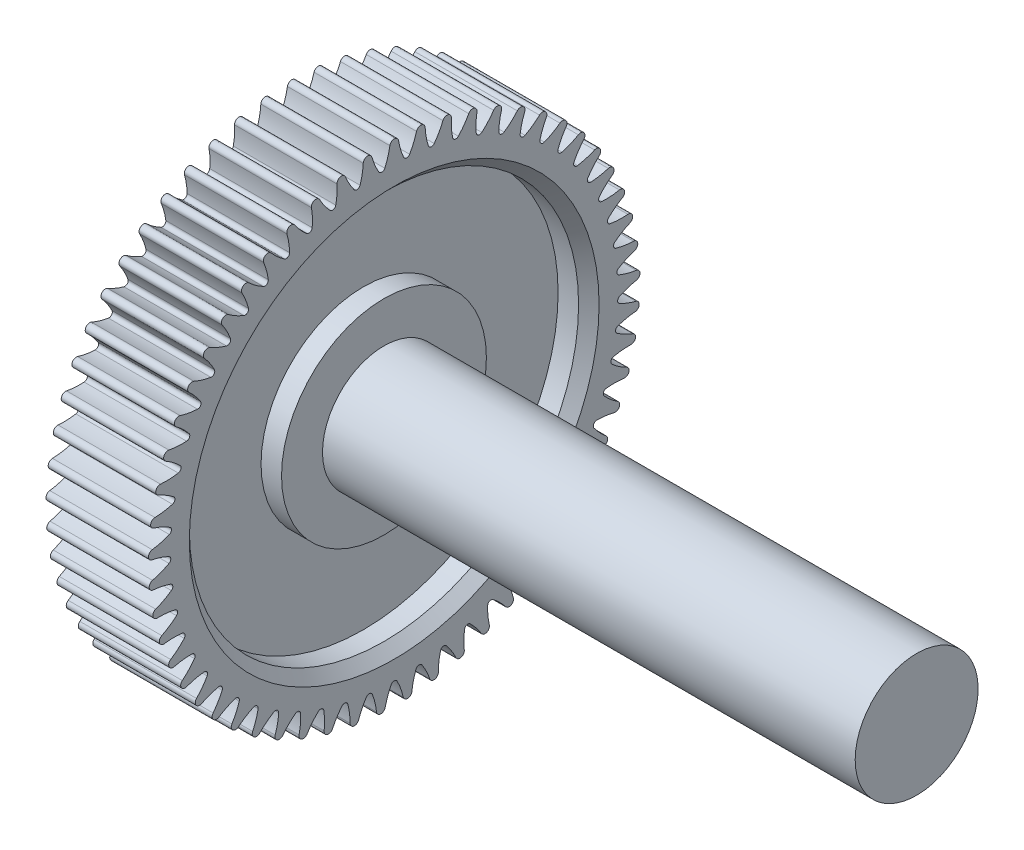
from build123d import *

# Parameters (mm, degrees)
CUT_EXTRUDE1_DEPTH = 10


with BuildPart() as part:
    # Sketch1 → Revolve1 (revolve)
    with BuildSketch(Plane.XY):
        with BuildLine():
            Line((0, 0), (61, 0))
            Line((61, 0), (61, -6))
            Line((61, -6), (9, -6))
            Line((9, -6), (9, -10))
            Line((9, -10), (7, -10))
            Line((7, -10), (7, -19))
            Line((7, -19), (9, -19))
            Line((9, -19), (10, -20))
            Line((10, -20), (10, -24))
            Line((10, -24), (0, -24))
            Line((0, -24), (0, -20))
            Line((0, -20), (1, -19))
            Line((1, -19), (3, -19))
            Line((3, -19), (3, -10))
            ThreePointArc((3, -10), (2.16227766, -7.550510257), (0, -6.127016654))
            Line((0, -6.127016654), (0, 0))
        make_face()
    revolve(axis=Axis((0, 0, 0), (1, 0, 0)))

    # Sketch3 → Cut-Extrude1 (cut)
    with BuildSketch(Plane(origin=(10, 0, 0), x_dir=(0, 0, -1), z_dir=(1, 0, 0))):
        with BuildLine():
            ThreePointArc((-0.92, 21.980755219), (-0.618669103, 22.793939627), (-0.424408131, 23.639121186))
            ThreePointArc((-0.424408131, 23.639121186), (-0.278547922, 23.897583661), (0, 24))
            ThreePointArc((0, 24), (-1.322106207, 23.963556397), (-2.640197222, 23.854336265))
            ThreePointArc((-2.640197222, 23.854336265), (-2.352073305, 23.783184053), (-2.178665406, 23.542336115))
            ThreePointArc((-2.178665406, 23.542336115), (-1.892606548, 22.72365454), (-1.503647555, 21.948554486))
            ThreePointArc((-1.503647555, 21.948554486), (-1.201993083, 21.786470696), (-0.92, 21.980755219))
        make_face()
        with BuildLine():
            ThreePointArc((2.640197229, 23.854336264), (1.322106211, 23.963556396), (0, 24))
            ThreePointArc((0, 24), (0.278547922, 23.897583661), (0.424408131, 23.639121186))
            ThreePointArc((0.424408131, 23.639121186), (0.618669103, 22.793939627), (0.92, 21.980755219))
            ThreePointArc((0.92, 21.980755219), (1.201993083, 21.786470696), (1.503647555, 21.948554486))
            ThreePointArc((1.503647555, 21.948554486), (1.892606548, 22.72365454), (2.178665406, 23.542336115))
            ThreePointArc((2.178665406, 23.542336115), (2.352073308, 23.783184055), (2.640197229, 23.854336264))
        make_face()
        with BuildLine():
            ThreePointArc((5.248346399, 23.419113136), (3.950270236, 23.67267127), (2.640197229, 23.854336264))
            ThreePointArc((2.640197229, 23.854336264), (2.905787964, 23.72189898), (3.022329929, 23.448959348))
            ThreePointArc((3.022329929, 23.448959348), (3.122434948, 22.587537165), (3.332480001, 21.74613936))
            ThreePointArc((3.332480001, 21.74613936), (3.591388683, 21.522012454), (3.909042865, 21.649928034))
            ThreePointArc((3.909042865, 21.649928034), (4.380908518, 22.377535069), (4.755292897, 23.159778975))
            ThreePointArc((4.755292897, 23.159778975), (4.954143712, 23.380088904), (5.248346399, 23.419113136))
        make_face()
        with BuildLine():
            ThreePointArc((-3.022329929, 23.448959348), (-2.905787962, 23.721898983), (-2.640197222, 23.854336265))
            ThreePointArc((-2.640197222, 23.854336265), (-3.950270132, 23.672671287), (-5.2483462, 23.41911318))
            ThreePointArc((-5.2483462, 23.41911318), (-4.954143622, 23.380088856), (-4.755292897, 23.159778975))
            ThreePointArc((-4.755292897, 23.159778975), (-4.380908518, 22.377535069), (-3.909042865, 21.649928034))
            ThreePointArc((-3.909042865, 21.649928034), (-3.591388683, 21.522012454), (-3.332480001, 21.74613936))
            ThreePointArc((-3.332480001, 21.74613936), (-3.122434948, 22.587537165), (-3.022329929, 23.448959348))
        make_face()
        with BuildLine():
            ThreePointArc((7.792786988, 22.699613894), (6.530483121, 23.094432017), (5.248346399, 23.419113136))
            ThreePointArc((5.248346399, 23.419113136), (5.497755792, 23.25826244), (5.583564735, 22.974158908))
            ThreePointArc((5.583564735, 22.974158908), (5.588298663, 22.1069526), (5.704508209, 21.247554826))
            ThreePointArc((5.704508209, 21.247554826), (5.937189688, 20.996306136), (6.26698769, 21.088500783))
            ThreePointArc((6.26698769, 21.088500783), (6.816032194, 21.759782635), (7.274197574, 22.496093491))
            ThreePointArc((7.274197574, 22.496093491), (7.496077168, 22.693190971), (7.792786988, 22.699613894))
        make_face()
        with BuildLine():
            ThreePointArc((-5.583564735, 22.974158908), (-5.497755731, 23.258262522), (-5.2483462, 23.41911318))
            ThreePointArc((-5.2483462, 23.41911318), (-6.530483116, 23.094432019), (-7.792787171, 22.699613832))
            ThreePointArc((-7.792787171, 22.699613832), (-7.496077258, 22.693191007), (-7.274197574, 22.496093491))
            ThreePointArc((-7.274197574, 22.496093491), (-6.816032194, 21.759782635), (-6.26698769, 21.088500783))
            ThreePointArc((-6.26698769, 21.088500783), (-5.937189688, 20.996306136), (-5.704508209, 21.247554826))
            ThreePointArc((-5.704508209, 21.247554826), (-5.588298663, 22.1069526), (-5.583564735, 22.974158908))
        make_face()
        with BuildLine():
            ThreePointArc((10.242634451, 21.704571857), (9.031424793, 22.235857667), (7.792786988, 22.699613894))
            ThreePointArc((7.792786988, 22.699613894), (8.022988084, 22.512302423), (8.077022629, 22.220483301))
            ThreePointArc((8.077022629, 22.220483301), (7.986328002, 21.358019577), (8.007291415, 20.49105376))
            ThreePointArc((8.007291415, 20.49105376), (8.210921253, 20.215733104), (8.548859774, 20.271087701))
            ThreePointArc((8.548859774, 20.271087701), (9.168418472, 20.877895917), (9.704803345, 21.559335906))
            ThreePointArc((9.704803345, 21.559335906), (9.947018763, 21.730828597), (10.242634451, 21.704571857))
        make_face()
        with BuildLine():
            ThreePointArc((-8.077022629, 22.220483301), (-8.022988133, 22.51230234), (-7.792787171, 22.699613832))
            ThreePointArc((-7.792787171, 22.699613832), (-9.031424873, 22.235857635), (-10.242634433, 21.704571866))
            ThreePointArc((-10.242634433, 21.704571866), (-9.947018753, 21.730828594), (-9.704803345, 21.559335906))
            ThreePointArc((-9.704803345, 21.559335906), (-9.168418472, 20.877895917), (-8.548859774, 20.271087701))
            ThreePointArc((-8.548859774, 20.271087701), (-8.210921253, 20.215733104), (-8.007291415, 20.49105376))
            ThreePointArc((-8.007291415, 20.49105376), (-7.986328002, 21.358019577), (-8.077022629, 22.220483301))
        make_face()
        with BuildLine():
            ThreePointArc((12.56814958, 20.446066031), (11.422737249, 21.107370129), (10.242634451, 21.704571857))
            ThreePointArc((10.242634451, 21.704571857), (10.45083238, 21.493073218), (10.47243641, 21.197081127))
            ThreePointArc((10.47243641, 21.197081127), (10.287414138, 20.349829128), (10.21287695, 19.485819059))
            ThreePointArc((10.21287695, 19.485819059), (10.384983358, 19.189768456), (10.726960281, 19.207611073))
            ThreePointArc((10.726960281, 19.207611073), (11.40951257, 19.742579824), (12.017605951, 20.360877189))
            ThreePointArc((12.017605951, 20.360877189), (12.277216685, 20.504683315), (12.56814958, 20.446066031))
        make_face()
        with BuildLine():
            ThreePointArc((-10.47243641, 21.197081127), (-10.450832376, 21.493073227), (-10.242634433, 21.704571866))
            ThreePointArc((-10.242634433, 21.704571866), (-11.422737525, 21.107369979), (-12.568150132, 20.446065691))
            ThreePointArc((-12.568150132, 20.446065691), (-12.277217006, 20.504683365), (-12.017605951, 20.360877189))
            ThreePointArc((-12.017605951, 20.360877189), (-11.40951257, 19.742579824), (-10.726960281, 19.207611073))
            ThreePointArc((-10.726960281, 19.207611073), (-10.384983358, 19.189768456), (-10.21287695, 19.485819059))
            ThreePointArc((-10.21287695, 19.485819059), (-10.287414138, 20.349829128), (-10.47243641, 21.197081127))
        make_face()
        with BuildLine():
            ThreePointArc((14.741104724, 18.939372522), (13.67539301, 19.722667822), (12.56814958, 20.446066031))
            ThreePointArc((12.56814958, 20.446066031), (12.75181759, 20.212947541), (12.740728999, 19.916375103))
            ThreePointArc((12.740728999, 19.916375103), (12.463625002, 19.094619321), (12.294491993, 18.244052911))
            ThreePointArc((12.294491993, 18.244052911), (12.432985832, 17.930866015), (12.774850021, 17.910980066))
            ThreePointArc((12.774850021, 17.910980066), (13.512110641, 18.367615556), (14.1845311, 18.915265004))
            ThreePointArc((14.1845311, 18.915265004), (14.458385997, 19.029639008), (14.741104724, 18.939372522))
        make_face()
        with BuildLine():
            ThreePointArc((-12.740728999, 19.916375103), (-12.75181769, 20.212947233), (-12.568150132, 20.446065691))
            ThreePointArc((-12.568150132, 20.446065691), (-13.67539335, 19.722667587), (-14.741104864, 18.939372413))
            ThreePointArc((-14.741104864, 18.939372413), (-14.458386085, 19.029639012), (-14.1845311, 18.915265004))
            ThreePointArc((-14.1845311, 18.915265004), (-13.512110641, 18.367615556), (-12.774850021, 17.910980066))
            ThreePointArc((-12.774850021, 17.910980066), (-12.432985832, 17.930866015), (-12.294491993, 18.244052911))
            ThreePointArc((-12.294491993, 18.244052911), (-12.463625002, 19.094619321), (-12.740728999, 19.916375103))
        make_face()
        with BuildLine():
            ThreePointArc((16.735122832, 17.2027807), (15.762048188, 18.098558974), (14.741104724, 18.939372522))
            ThreePointArc((14.741104724, 18.939372522), (14.898013087, 18.687463905), (14.854366398, 18.393911265))
            ThreePointArc((14.854366398, 18.393911265), (14.488544342, 17.607626701), (14.226868559, 16.780828675))
            ThreePointArc((14.226868559, 16.780828675), (14.3300687, 16.45430715), (14.667670388, 16.396934024))
            ThreePointArc((14.667670388, 16.396934024), (15.450689992, 16.769693317), (16.179275257, 17.240047125))
            ThreePointArc((16.179275257, 17.240047125), (16.464050086, 17.323600669), (16.735122832, 17.2027807))
        make_face()
        with BuildLine():
            ThreePointArc((-14.854366398, 18.393911265), (-14.898013106, 18.687463818), (-14.741104864, 18.939372413))
            ThreePointArc((-14.741104864, 18.939372413), (-15.762048321, 18.098558857), (-16.735122958, 17.202780577))
            ThreePointArc((-16.735122958, 17.202780577), (-16.464050174, 17.323600663), (-16.179275257, 17.240047125))
            ThreePointArc((-16.179275257, 17.240047125), (-15.450689992, 16.769693317), (-14.667670388, 16.396934024))
            ThreePointArc((-14.667670388, 16.396934024), (-14.3300687, 16.45430715), (-14.226868559, 16.780828675))
            ThreePointArc((-14.226868559, 16.780828675), (-14.488544342, 17.607626701), (-14.854366398, 18.393911265))
        make_face()
        with BuildLine():
            ThreePointArc((18.525999644, 15.25736993), (17.657373682, 16.254757909), (16.735122832, 17.2027807))
            ThreePointArc((16.735122832, 17.2027807), (16.863366895, 16.935139774), (16.78769191, 16.64817026))
            ThreePointArc((16.78769191, 16.64817026), (16.337592381, 15.906901345), (15.986550212, 15.11390791))
            ThreePointArc((15.986550212, 15.11390791), (16.053203946, 14.778015286), (16.382445105, 14.683851415))
            ThreePointArc((16.382445105, 14.683851415), (17.201718897, 14.968209718), (17.977624928, 15.355558428))
            ThreePointArc((17.977624928, 15.355558428), (18.269863232, 15.407277234), (18.525999644, 15.25736993))
        make_face()
        with BuildLine():
            ThreePointArc((-16.78769191, 16.64817026), (-16.863366903, 16.935139686), (-16.735122958, 17.202780577))
            ThreePointArc((-16.735122958, 17.202780577), (-17.657373715, 16.254757872), (-18.525999595, 15.25736999))
            ThreePointArc((-18.525999595, 15.25736999), (-18.269863194, 15.407277241), (-17.977624928, 15.355558428))
            ThreePointArc((-17.977624928, 15.355558428), (-17.201718897, 14.968209718), (-16.382445105, 14.683851415))
            ThreePointArc((-16.382445105, 14.683851415), (-16.053203946, 14.778015286), (-15.986550212, 15.11390791))
            ThreePointArc((-15.986550212, 15.11390791), (-16.337592381, 15.906901345), (-16.78769191, 16.64817026))
        make_face()
        with BuildLine():
            ThreePointArc((20.09199551, 13.126755746), (19.338362563, 14.213646027), (18.525999644, 15.25736993))
            ThreePointArc((18.525999644, 15.25736993), (18.624022274, 14.977245661), (18.517237584, 14.700343021))
            ThreePointArc((18.517237584, 14.700343021), (17.988324179, 14.013087755), (17.552176802, 13.263524778))
            ThreePointArc((17.552176802, 13.263524778), (17.581475043, 12.922338336), (17.898359131, 12.792526741))
            ThreePointArc((17.898359131, 12.792526741), (18.743942237, 12.985032329), (19.557750587, 13.284674053))
            ThreePointArc((19.557750587, 13.284674053), (19.853904707, 13.303930342), (20.09199551, 13.126755746))
        make_face()
        with BuildLine():
            ThreePointArc((-18.517237584, 14.700343021), (-18.624022274, 14.9772457), (-18.525999595, 15.25736999))
            ThreePointArc((-18.525999595, 15.25736999), (-19.338362541, 14.213646058), (-20.09199551, 13.126755746))
            ThreePointArc((-20.09199551, 13.126755746), (-19.853904707, 13.303930342), (-19.557750587, 13.284674053))
            ThreePointArc((-19.557750587, 13.284674053), (-18.743942237, 12.985032329), (-17.898359131, 12.792526741))
            ThreePointArc((-17.898359131, 12.792526741), (-17.581475043, 12.922338336), (-17.552176802, 13.263524778))
            ThreePointArc((-17.552176802, 13.263524778), (-17.988324179, 14.013087755), (-18.517237584, 14.700343021))
        make_face()
        with BuildLine():
            ThreePointArc((21.414101755, 10.836800544), (20.784609721, 11.999999948), (20.09199551, 13.126755746))
            ThreePointArc((20.09199551, 13.126755746), (20.158607222, 12.837548355), (20.022009078, 12.574073532))
            ThreePointArc((20.022009078, 12.574073532), (19.42070209, 11.949174262), (18.904743742, 11.252140421))
            ThreePointArc((18.904743742, 11.252140421), (18.896330849, 10.909801703), (19.197011323, 10.745918122))
            ThreePointArc((19.197011323, 10.745918122), (20.05863951, 10.844234238), (20.900471646, 11.05253173))
            ThreePointArc((20.900471646, 11.05253173), (21.196946664, 11.039091758), (21.414101755, 10.836800544))
        make_face()
        with BuildLine():
            ThreePointArc((-20.022009078, 12.574073532), (-20.158607222, 12.837548355), (-20.09199551, 13.126755746))
            ThreePointArc((-20.09199551, 13.126755746), (-20.78460969, 12.000000002), (-21.414101699, 10.836800655))
            ThreePointArc((-21.414101699, 10.836800655), (-21.196946607, 11.039091782), (-20.900471646, 11.05253173))
            ThreePointArc((-20.900471646, 11.05253173), (-20.05863951, 10.844234238), (-19.197011323, 10.745918122))
            ThreePointArc((-19.197011323, 10.745918122), (-18.896330849, 10.909801703), (-18.904743742, 11.252140421))
            ThreePointArc((-18.904743742, 11.252140421), (-19.42070209, 11.949174262), (-20.022009078, 12.574073532))
        make_face()
        with BuildLine():
            ThreePointArc((22.476269758, 8.415301408), (21.978559834, 9.640690204), (21.414101755, 10.836800544))
            ThreePointArc((21.414101755, 10.836800544), (21.448493986, 10.542020611), (21.283740504, 10.295171823))
            ThreePointArc((21.283740504, 10.295171823), (20.617338985, 9.74021398), (20.027832702, 9.104170323))
            ThreePointArc((20.027832702, 9.104170323), (19.981810797, 8.764834856), (20.262637802, 8.568868613))
            ThreePointArc((20.262637802, 8.568868613), (21.129852071, 8.571801833), (21.989489293, 8.686226645))
            ThreePointArc((21.989489293, 8.686226645), (22.282686335, 8.640253592), (22.476269758, 8.415301408))
        make_face()
        with BuildLine():
            ThreePointArc((-21.283740504, 10.295171823), (-21.448494, 10.542020672), (-21.414101699, 10.836800655))
            ThreePointArc((-21.414101699, 10.836800655), (-21.97855981, 9.640690261), (-22.476269758, 8.415301408))
            ThreePointArc((-22.476269758, 8.415301408), (-22.282686335, 8.640253592), (-21.989489293, 8.686226645))
            ThreePointArc((-21.989489293, 8.686226645), (-21.129852071, 8.571801833), (-20.262637802, 8.568868613))
            ThreePointArc((-20.262637802, 8.568868613), (-19.981810797, 8.764834856), (-20.027832702, 9.104170323))
            ThreePointArc((-20.027832702, 9.104170323), (-20.617338985, 9.74021398), (-21.283740504, 10.295171823))
        make_face()
        with BuildLine():
            ThreePointArc((23.265606381, 5.891651696), (22.905720031, 7.164355508), (22.476269758, 8.415301408))
            ThreePointArc((22.476269758, 8.415301408), (22.478025113, 8.118527091), (22.287116152, 7.891300674))
            ThreePointArc((22.287116152, 7.891300674), (21.563709314, 7.413020695), (20.907810903, 6.845687929))
            ThreePointArc((20.907810903, 6.845687929), (20.824738629, 6.513474787), (21.082303307, 6.287804647))
            ThreePointArc((21.082303307, 6.287804647), (21.94457685, 6.195319366), (22.811584327, 6.214482535))
            ThreePointArc((22.811584327, 6.214482535), (23.097944482, 6.136534398), (23.265606381, 5.891651696))
        make_face()
        with BuildLine():
            ThreePointArc((-22.287116152, 7.891300674), (-22.478025113, 8.118527091), (-22.476269758, 8.415301408))
            ThreePointArc((-22.476269758, 8.415301408), (-22.905720023, 7.164355535), (-23.265606368, 5.891651749))
            ThreePointArc((-23.265606368, 5.891651749), (-23.09794446, 6.136534414), (-22.811584327, 6.214482535))
            ThreePointArc((-22.811584327, 6.214482535), (-21.94457685, 6.195319366), (-21.082303307, 6.287804647))
            ThreePointArc((-21.082303307, 6.287804647), (-20.824738629, 6.513474787), (-20.907810903, 6.845687929))
            ThreePointArc((-20.907810903, 6.845687929), (-21.563709314, 7.413020695), (-22.287116152, 7.891300674))
        make_face()
        with BuildLine():
            ThreePointArc((23.772530026, 3.296485424), (23.554835834, 4.601055186), (23.265606381, 5.891651696))
            ThreePointArc((23.265606381, 5.891651696), (23.23470343, 5.596485538), (23.019956401, 5.391639825))
            ThreePointArc((23.019956401, 5.391639825), (22.248325423, 4.995843381), (21.533996603, 4.504108158))
            ThreePointArc((21.533996603, 4.504108158), (21.414882344, 4.183049957), (21.646058208, 3.930415251))
            ThreePointArc((21.646058208, 3.930415251), (22.492924194, 3.743634114), (23.356777629, 3.667303025))
            ThreePointArc((23.356777629, 3.667303025), (23.632824824, 3.55832602), (23.772530026, 3.296485424))
        make_face()
        with BuildLine():
            ThreePointArc((-23.019956401, 5.391639825), (-23.234703442, 5.596485563), (-23.265606368, 5.891651749))
            ThreePointArc((-23.265606368, 5.891651749), (-23.554835829, 4.601055213), (-23.772530026, 3.296485424))
            ThreePointArc((-23.772530026, 3.296485424), (-23.632824824, 3.55832602), (-23.356777629, 3.667303025))
            ThreePointArc((-23.356777629, 3.667303025), (-22.492924194, 3.743634114), (-21.646058208, 3.930415251))
            ThreePointArc((-21.646058208, 3.930415251), (-21.414882344, 4.183049957), (-21.533996603, 4.504108158))
            ThreePointArc((-21.533996603, 4.504108158), (-22.248325423, 4.995843381), (-23.019956401, 5.391639825))
        make_face()
        with BuildLine():
            ThreePointArc((23.99088737, 0.661304173), (23.918027832, 1.981904288), (23.772530026, 3.296485424))
            ThreePointArc((23.772530026, 3.296485424), (23.709343944, 3.006510286), (23.473365563, 2.826531772))
            ThreePointArc((23.473365563, 2.826531772), (22.662876999, 2.518023295), (21.898788755, 2.107854615))
            ThreePointArc((21.898788755, 2.107854615), (21.745078397, 1.801848568), (21.947059286, 1.525315937))
            ThreePointArc((21.947059286, 1.525315937), (22.768237908, 1.246506215), (23.61845129, 1.075607425))
            ThreePointArc((23.61845129, 1.075607425), (23.880834726, 0.936924345), (23.99088737, 0.661304173))
        make_face()
        with BuildLine():
            ThreePointArc((-23.473365563, 2.826531772), (-23.709343944, 3.006510286), (-23.772530026, 3.296485424))
            ThreePointArc((-23.772530026, 3.296485424), (-23.91802783, 1.981904312), (-23.990887368, 0.661304221))
            ThreePointArc((-23.990887368, 0.661304221), (-23.88083471, 0.936924363), (-23.61845129, 1.075607425))
            ThreePointArc((-23.61845129, 1.075607425), (-22.768237908, 1.246506215), (-21.947059286, 1.525315937))
            ThreePointArc((-21.947059286, 1.525315937), (-21.745078397, 1.801848568), (-21.898788755, 2.107854615))
            ThreePointArc((-21.898788755, 2.107854615), (-22.662876999, 2.518023295), (-23.473365563, 2.826531772))
        make_face()
        with BuildLine():
            ThreePointArc((23.918027836, -1.981904251), (23.990887369, -0.661304219), (23.99088737, 0.661304173))
            ThreePointArc((23.99088737, 0.661304173), (23.896185107, 0.380040025), (23.641839864, 0.227113452))
            ThreePointArc((23.641839864, 0.227113452), (22.802331949, 0.009637818), (21.997759276, -0.313985428))
            ThreePointArc((21.997759276, -0.313985428), (21.811318655, -0.601224823), (21.981652794, -0.898298645))
            ThreePointArc((21.981652794, -0.898298645), (22.767176057, -1.265752581), (23.593428948, -1.529144593))
            ThreePointArc((23.593428948, -1.529144593), (23.83896359, -1.69585026), (23.918027836, -1.981904251))
        make_face()
        with BuildLine():
            ThreePointArc((-23.641839864, 0.227113452), (-23.896185122, 0.380040044), (-23.990887368, 0.661304221))
            ThreePointArc((-23.990887368, 0.661304221), (-23.990887367, -0.66130426), (-23.918027825, -1.981904381))
            ThreePointArc((-23.918027825, -1.981904381), (-23.838963628, -1.695850314), (-23.593428948, -1.529144593))
            ThreePointArc((-23.593428948, -1.529144593), (-22.767176057, -1.265752581), (-21.981652794, -0.898298645))
            ThreePointArc((-21.981652794, -0.898298645), (-21.811318655, -0.601224823), (-21.997759276, -0.313985428))
            ThreePointArc((-21.997759276, -0.313985428), (-22.802331949, 0.009637818), (-23.641839864, 0.227113452))
        make_face()
        with BuildLine():
            ThreePointArc((-23.523334256, -2.375061717), (-23.79295896, -2.251043389), (-23.918027825, -1.981904381))
            ThreePointArc((-23.918027825, -1.981904381), (-23.772530029, -3.296485403), (-23.554835849, -4.601055108))
            ThreePointArc((-23.554835849, -4.601055108), (-23.507719753, -4.308039565), (-23.282014338, -4.115334867))
            ThreePointArc((-23.282014338, -4.115334867), (-22.489751529, -3.762646855), (-21.749418814, -3.311009099))
            ThreePointArc((-21.749418814, -3.311009099), (-21.612799051, -2.997000158), (-21.829706798, -2.732014113))
            ThreePointArc((-21.829706798, -2.732014113), (-22.664997478, -2.498864649), (-23.523334256, -2.375061717))
        make_face()
        with BuildLine():
            ThreePointArc((23.554835833, -4.601055193), (23.772530032, -3.296485381), (23.918027836, -1.981904251))
            ThreePointArc((23.918027836, -1.981904251), (23.792959006, -2.251043343), (23.523334256, -2.375061717))
            ThreePointArc((23.523334256, -2.375061717), (22.664997478, -2.498864649), (21.829706798, -2.732014113))
            ThreePointArc((21.829706798, -2.732014113), (21.612799051, -2.997000158), (21.749418814, -3.311009099))
            ThreePointArc((21.749418814, -3.311009099), (22.489751529, -3.762646855), (23.282014338, -4.115334867))
            ThreePointArc((23.282014338, -4.115334867), (23.507719774, -4.308039603), (23.554835833, -4.601055193))
        make_face()
        with BuildLine():
            ThreePointArc((-23.119287236, -4.948406855), (-23.400918594, -4.854802121), (-23.554835849, -4.601055108))
            ThreePointArc((-23.554835849, -4.601055108), (-23.265606392, -5.891651655), (-22.90572005, -7.164355448))
            ThreePointArc((-22.90572005, -7.164355448), (-22.891124056, -6.867935132), (-22.687987613, -6.65157055))
            ThreePointArc((-22.687987613, -6.65157055), (-21.939331883, -6.213867694), (-21.253176352, -5.683528388))
            ThreePointArc((-21.253176352, -5.683528388), (-21.151929344, -5.356395971), (-21.396671251, -5.116879847))
            ThreePointArc((-21.396671251, -5.116879847), (-22.25254064, -4.977034285), (-23.119287236, -4.948406855))
        make_face()
        with BuildLine():
            ThreePointArc((22.905720023, -7.164355535), (23.26560637, -5.891651741), (23.554835833, -4.601055193))
            ThreePointArc((23.554835833, -4.601055193), (23.40091856, -4.854802148), (23.119287236, -4.948406855))
            ThreePointArc((23.119287236, -4.948406855), (22.25254064, -4.977034285), (21.396671251, -5.116879847))
            ThreePointArc((21.396671251, -5.116879847), (21.151929344, -5.356395971), (21.253176352, -5.683528388))
            ThreePointArc((21.253176352, -5.683528388), (21.939331883, -6.213867694), (22.687987613, -6.65157055))
            ThreePointArc((22.687987613, -6.65157055), (22.891124074, -6.867935174), (22.905720023, -7.164355535))
        make_face()
        with BuildLine():
            ThreePointArc((-22.434603387, -7.461685036), (-22.724822706, -7.399630196), (-22.90572005, -7.164355448))
            ThreePointArc((-22.90572005, -7.164355448), (-22.476269804, -8.415301283), (-21.978559868, -9.640690127))
            ThreePointArc((-21.978559868, -9.640690127), (-21.996661104, -9.344463225), (-21.818559452, -9.107065177))
            ThreePointArc((-21.818559452, -9.107065177), (-21.122598468, -8.589660596), (-20.49894912, -7.987057341))
            ThreePointArc((-20.49894912, -7.987057341), (-20.434303867, -7.650772393), (-20.7039091, -7.439633592))
            ThreePointArc((-20.7039091, -7.439633592), (-21.569968103, -7.394789466), (-22.434603387, -7.461685036))
        make_face()
        with BuildLine():
            ThreePointArc((21.978559826, -9.640690224), (22.47626977, -8.415301376), (22.905720023, -7.164355535))
            ThreePointArc((22.905720023, -7.164355535), (22.724822667, -7.39963022), (22.434603387, -7.461685036))
            ThreePointArc((22.434603387, -7.461685036), (21.569968103, -7.394789466), (20.7039091, -7.439633592))
            ThreePointArc((20.7039091, -7.439633592), (20.434303867, -7.650772393), (20.49894912, -7.987057341))
            ThreePointArc((20.49894912, -7.987057341), (21.122598468, -8.589660596), (21.818559452, -9.107065177))
            ThreePointArc((21.818559452, -9.107065177), (21.996661119, -9.344463276), (21.978559826, -9.640690224))
        make_face()
        with BuildLine():
            ThreePointArc((-21.477593843, -9.884388469), (-21.772878294, -9.854636759), (-21.978559868, -9.640690127))
            ThreePointArc((-21.978559868, -9.640690127), (-21.414101755, -10.836800544), (-20.784609718, -11.999999953))
            ThreePointArc((-20.784609718, -11.999999953), (-20.835188496, -11.707562227), (-20.684283535, -11.45201237))
            ThreePointArc((-20.684283535, -11.45201237), (-20.049465321, -10.861186654), (-19.495892414, -10.193634238))
            ThreePointArc((-19.495892414, -10.193634238), (-19.468633623, -9.852278802), (-19.759829539, -9.672080262))
            ThreePointArc((-19.759829539, -9.672080262), (-20.625565372, -9.72278192), (-21.477593843, -9.884388469))
        make_face()
        with BuildLine():
            ThreePointArc((20.784609718, -11.999999953), (21.414101731, -10.836800591), (21.978559826, -9.640690224))
            ThreePointArc((21.978559826, -9.640690224), (21.772878246, -9.854636782), (21.477593843, -9.884388469))
            ThreePointArc((21.477593843, -9.884388469), (20.625565372, -9.72278192), (19.759829539, -9.672080262))
            ThreePointArc((19.759829539, -9.672080262), (19.468633623, -9.852278802), (19.495892414, -10.193634238))
            ThreePointArc((19.495892414, -10.193634238), (20.049465321, -10.861186654), (20.684283535, -11.45201237))
            ThreePointArc((20.684283535, -11.45201237), (20.835188496, -11.707562227), (20.784609718, -11.999999953))
        make_face()
        with BuildLine():
            ThreePointArc((-20.259875404, -12.187108816), (-20.556640604, -12.190021398), (-20.784609718, -11.999999953))
            ThreePointArc((-20.784609718, -11.999999953), (-20.09199551, -13.126755746), (-19.338362573, -14.213646013))
            ThreePointArc((-19.338362573, -14.213646013), (-19.420804921, -13.92854727), (-19.298928437, -13.657947646))
            ThreePointArc((-19.298928437, -13.657947646), (-18.732958825, -13.00087262), (-18.256181984, -12.276474224))
            ThreePointArc((-18.256181984, -12.276474224), (-18.26664054, -11.934191893), (-18.575892414, -11.787120981))
            ThreePointArc((-18.575892414, -11.787120981), (-19.430796218, -11.932752973), (-20.259875404, -12.187108816))
        make_face()
        with BuildLine():
            ThreePointArc((19.338362549, -14.213646046), (20.091995499, -13.126755763), (20.784609718, -11.999999953))
            ThreePointArc((20.784609718, -11.999999953), (20.556640604, -12.190021398), (20.259875404, -12.187108816))
            ThreePointArc((20.259875404, -12.187108816), (19.430796218, -11.932752973), (18.575892414, -11.787120981))
            ThreePointArc((18.575892414, -11.787120981), (18.26664054, -11.934191893), (18.256181984, -12.276474224))
            ThreePointArc((18.256181984, -12.276474224), (18.732958825, -13.00087262), (19.298928437, -13.657947646))
            ThreePointArc((19.298928437, -13.657947646), (19.420804922, -13.92854729), (19.338362549, -14.213646046))
        make_face()
        with BuildLine():
            ThreePointArc((-18.796229523, -14.341894171), (-19.090873155, -14.377435686), (-19.338362573, -14.213646013))
            ThreePointArc((-19.338362573, -14.213646013), (-18.525999639, -15.257369937), (-17.657373849, -16.254757727))
            ThreePointArc((-17.657373849, -16.254757727), (-17.770679081, -15.980458659), (-17.67931049, -15.698093939))
            ThreePointArc((-17.67931049, -15.698093939), (-17.189059584, -14.982745603), (-16.794866235, -14.210294442))
            ThreePointArc((-16.794866235, -14.210294442), (-16.842915185, -13.871240061), (-17.166469119, -13.759082018))
            ThreePointArc((-17.166469119, -13.759082018), (-18.00016352, -13.997876569), (-18.796229523, -14.341894171))
        make_face()
        with BuildLine():
            ThreePointArc((17.657373901, -16.25475767), (18.52599965, -15.257369923), (19.338362549, -14.213646046))
            ThreePointArc((19.338362549, -14.213646046), (19.090873135, -14.377435691), (18.796229523, -14.341894171))
            ThreePointArc((18.796229523, -14.341894171), (18.00016352, -13.997876569), (17.166469119, -13.759082018))
            ThreePointArc((17.166469119, -13.759082018), (16.842915185, -13.871240061), (16.794866235, -14.210294442))
            ThreePointArc((16.794866235, -14.210294442), (17.189059584, -14.982745603), (17.67931049, -15.698093939))
            ThreePointArc((17.67931049, -15.698093939), (17.770679083, -15.98045862), (17.657373901, -16.25475767))
        make_face()
        with BuildLine():
            ThreePointArc((-17.104422878, -16.322588358), (-17.393368327, -16.390327387), (-17.657373849, -16.254757727))
            ThreePointArc((-17.657373849, -16.254757727), (-16.735123228, -17.202780315), (-15.762048589, -18.098558625))
            ThreePointArc((-15.762048589, -18.098558625), (-15.90484127, -17.838388877), (-15.845089662, -17.547686636))
            ThreePointArc((-15.845089662, -17.547686636), (-15.436508446, -16.78274835), (-15.129683561, -15.971620936))
            ThreePointArc((-15.129683561, -15.971620936), (-15.214739655, -15.639910165), (-15.548668143, -15.564026438))
            ThreePointArc((-15.548668143, -15.564026438), (-16.35103322, -15.893084906), (-17.104422878, -16.322588358))
        make_face()
        with BuildLine():
            ThreePointArc((15.762048531, -18.098558675), (16.735123228, -17.202780314), (17.657373901, -16.25475767))
            ThreePointArc((17.657373901, -16.25475767), (17.393368365, -16.390327383), (17.104422878, -16.322588358))
            ThreePointArc((17.104422878, -16.322588358), (16.35103322, -15.893084906), (15.548668143, -15.564026438))
            ThreePointArc((15.548668143, -15.564026438), (15.214739655, -15.639910165), (15.129683561, -15.971620936))
            ThreePointArc((15.129683561, -15.971620936), (15.436508446, -16.78274835), (15.845089662, -17.547686636))
            ThreePointArc((15.845089662, -17.547686636), (15.904841264, -17.838388915), (15.762048531, -18.098558675))
        make_face()
        with BuildLine():
            ThreePointArc((-15.204991708, -18.105148434), (-15.484731617, -18.204262708), (-15.762048589, -18.098558625))
            ThreePointArc((-15.762048589, -18.098558625), (-14.741105125, -18.939372209), (-13.675393411, -19.722667544))
            ThreePointArc((-13.675393411, -19.722667544), (-13.845940233, -19.479785221), (-13.818530911, -19.184274189))
            ThreePointArc((-13.818530911, -19.184274189), (-13.496579006, -18.379031268), (-13.280847024, -17.539073588))
            ThreePointArc((-13.280847024, -17.539073588), (-13.401877797, -17.218732946), (-13.742127399, -17.180044661))
            ThreePointArc((-13.742127399, -17.180044661), (-14.503423527, -17.595372721), (-15.204991708, -18.105148434))
        make_face()
        with BuildLine():
            ThreePointArc((13.675393411, -19.722667544), (14.741105095, -18.939372233), (15.762048531, -18.098558675))
            ThreePointArc((15.762048531, -18.098558675), (15.484731579, -18.204262709), (15.204991708, -18.105148434))
            ThreePointArc((15.204991708, -18.105148434), (14.503423527, -17.595372721), (13.742127399, -17.180044661))
            ThreePointArc((13.742127399, -17.180044661), (13.401877797, -17.218732946), (13.280847024, -17.539073588))
            ThreePointArc((13.280847024, -17.539073588), (13.496579006, -18.379031268), (13.818530911, -19.184274189))
            ThreePointArc((13.818530911, -19.184274189), (13.845940233, -19.479785221), (13.675393411, -19.722667544))
        make_face()
        with BuildLine():
            ThreePointArc((-13.120992537, -19.667936534), (-13.38813124, -19.797222942), (-13.675393411, -19.722667544))
            ThreePointArc((-13.675393411, -19.722667544), (-12.568149943, -20.446065808), (-11.422737414, -21.107370039))
            ThreePointArc((-11.422737414, -21.107370039), (-11.618968226, -20.884723399), (-11.624233913, -20.587990641))
            ThreePointArc((-11.624233913, -20.587990641), (-11.392819379, -19.752217642), (-11.270798995, -18.893625645))
            ThreePointArc((-11.270798995, -18.893625645), (-11.426335297, -18.588543634), (-11.768775844, -18.587520414))
            ThreePointArc((-11.768775844, -18.587520414), (-12.479761918, -19.084076547), (-13.120992537, -19.667936534))
        make_face()
        with BuildLine():
            ThreePointArc((11.422737482, -21.107370003), (12.568149975, -20.446065788), (13.675393411, -19.722667544))
            ThreePointArc((13.675393411, -19.722667544), (13.38813124, -19.797222942), (13.120992537, -19.667936534))
            ThreePointArc((13.120992537, -19.667936534), (12.479761918, -19.084076547), (11.768775844, -18.587520414))
            ThreePointArc((11.768775844, -18.587520414), (11.426335297, -18.588543634), (11.270798995, -18.893625645))
            ThreePointArc((11.270798995, -18.893625645), (11.392819379, -19.752217642), (11.624233913, -20.587990641))
            ThreePointArc((11.624233913, -20.587990641), (11.61896824, -20.884723364), (11.422737482, -21.107370003))
        make_face()
        with BuildLine():
            ThreePointArc((-10.877722291, -20.991982528), (-11.129017047, -21.149871702), (-11.422737414, -21.107370039))
            ThreePointArc((-11.422737414, -21.107370039), (-10.242634471, -21.704571848), (-9.031424985, -22.235857589))
            ThreePointArc((-9.031424985, -22.235857589), (-9.250957711, -22.036149261), (-9.288834462, -21.741796775))
            ThreePointArc((-9.288834462, -21.741796775), (-9.150766359, -20.885638852), (-9.123938733, -20.018834681))
            ThreePointArc((-9.123938733, -20.018834681), (-9.312092565, -19.732714583), (-9.652567292, -19.769368848))
            ThreePointArc((-9.652567292, -19.769368848), (-10.304612906, -20.341125535), (-10.877722291, -20.991982528))
        make_face()
        with BuildLine():
            ThreePointArc((9.031424985, -22.235857589), (10.242634505, -21.704571831), (11.422737482, -21.107370003))
            ThreePointArc((11.422737482, -21.107370003), (11.129017084, -21.14987171), (10.877722291, -20.991982528))
            ThreePointArc((10.877722291, -20.991982528), (10.304612906, -20.341125535), (9.652567292, -19.769368848))
            ThreePointArc((9.652567292, -19.769368848), (9.312092565, -19.732714583), (9.123938733, -20.018834681))
            ThreePointArc((9.123938733, -20.018834681), (9.150766359, -20.885638852), (9.288834462, -21.741796775))
            ThreePointArc((9.288834462, -21.741796775), (9.250957711, -22.036149261), (9.031424985, -22.235857589))
        make_face()
        with BuildLine():
            ThreePointArc((-8.502411231, -22.06121429), (-8.734811731, -22.245789686), (-9.031424985, -22.235857589))
            ThreePointArc((-9.031424985, -22.235857589), (-7.792787307, -22.699613785), (-6.53048319, -23.094431998))
            ThreePointArc((-6.53048319, -23.094431998), (-6.770653078, -22.920086172), (-6.840681144, -22.631686949))
            ThreePointArc((-6.840681144, -22.631686949), (-6.79763543, -21.765536698), (-6.866326215, -20.901042182))
            ThreePointArc((-6.866326215, -20.901042182), (-7.084813644, -20.637357108), (-7.41918965, -20.711243926))
            ThreePointArc((-7.41918965, -20.711243926), (-8.004379852, -21.351260815), (-8.502411231, -22.06121429))
        make_face()
        with BuildLine():
            ThreePointArc((6.53048319, -23.094431998), (7.792787307, -22.699613785), (9.031424985, -22.235857589))
            ThreePointArc((9.031424985, -22.235857589), (8.734811731, -22.245789686), (8.502411231, -22.06121429))
            ThreePointArc((8.502411231, -22.06121429), (8.004379852, -21.351260815), (7.41918965, -20.711243926))
            ThreePointArc((7.41918965, -20.711243926), (7.084813644, -20.637357108), (6.866326215, -20.901042182))
            ThreePointArc((6.866326215, -20.901042182), (6.79763543, -21.765536698), (6.840681144, -22.631686949))
            ThreePointArc((6.840681144, -22.631686949), (6.770653078, -22.920086172), (6.53048319, -23.094431998))
        make_face()
        with BuildLine():
            ThreePointArc((-6.023892417, -22.862652795), (-6.234577579, -23.071673904), (-6.53048319, -23.094431998))
            ThreePointArc((-6.53048319, -23.094431998), (-5.248346236, -23.419113173), (-3.950270227, -23.672671272))
            ThreePointArc((-3.950270227, -23.672671272), (-4.208161903, -23.525804263), (-4.309491223, -23.246859101))
            ThreePointArc((-4.309491223, -23.246859101), (-4.361990416, -22.381230413), (-4.525365798, -21.529539345))
            ThreePointArc((-4.525365798, -21.529539345), (-4.771534682, -21.291490073), (-5.095753095, -21.401712558))
            ThreePointArc((-5.095753095, -21.401712558), (-5.60698447, -22.102220711), (-6.023892417, -22.862652795))
        make_face()
        with BuildLine():
            ThreePointArc((3.950270149, -23.672671285), (5.248346198, -23.419113181), (6.53048319, -23.094431998))
            ThreePointArc((6.53048319, -23.094431998), (6.234577579, -23.071673904), (6.023892417, -22.862652795))
            ThreePointArc((6.023892417, -22.862652795), (5.60698447, -22.102220711), (5.095753095, -21.401712558))
            ThreePointArc((5.095753095, -21.401712558), (4.771534682, -21.291490073), (4.525365798, -21.529539345))
            ThreePointArc((4.525365798, -21.529539345), (4.361990416, -22.381230413), (4.309491223, -23.246859101))
            ThreePointArc((4.309491223, -23.246859101), (4.208161878, -23.525804293), (3.950270149, -23.672671285))
        make_face()
        with BuildLine():
            ThreePointArc((-3.472251709, -23.386569666), (-3.658664126, -23.617499265), (-3.950270227, -23.672671272))
            ThreePointArc((-3.950270227, -23.672671272), (-2.640197306, -23.854336255), (-1.322106192, -23.963556397))
            ThreePointArc((-1.322106192, -23.963556397), (-1.594589293, -23.845951011), (-1.725989917, -23.579845875))
            ThreePointArc((-1.725989917, -23.579845875), (-1.873396748, -22.725246309), (-2.129473571, -21.896697064))
            ThreePointArc((-2.129473571, -21.896697064), (-2.400335753, -21.687173191), (-2.710461, -21.832393391))
            ThreePointArc((-2.710461, -21.832393391), (-3.141527891, -22.584889588), (-3.472251709, -23.386569666))
        make_face()
        with BuildLine():
            ThreePointArc((1.32210632, -23.96355639), (2.640197331, -23.854336253), (3.950270149, -23.672671285))
            ThreePointArc((3.950270149, -23.672671285), (3.658664092, -23.617499245), (3.472251709, -23.386569666))
            ThreePointArc((3.472251709, -23.386569666), (3.141527891, -22.584889588), (2.710461, -21.832393391))
            ThreePointArc((2.710461, -21.832393391), (2.400335753, -21.687173191), (2.129473571, -21.896697064))
            ThreePointArc((2.129473571, -21.896697064), (1.873396748, -22.725246309), (1.725989917, -23.579845875))
            ThreePointArc((1.725989917, -23.579845875), (1.59458934, -23.845950967), (1.32210632, -23.96355639))
        make_face()
        with BuildLine():
            ThreePointArc((-0.878462569, -23.626605262), (-1.038339387, -23.876640137), (-1.322106192, -23.963556397))
            ThreePointArc((-1.322106192, -23.963556397), (6.4e-08, -24), (1.32210632, -23.96355639))
            ThreePointArc((1.32210632, -23.96355639), (1.038339438, -23.876640176), (0.878462569, -23.626605262))
            ThreePointArc((0.878462569, -23.626605262), (0.63793742, -22.7934085), (0.292267581, -21.998058543))
            ThreePointArc((0.292267581, -21.998058543), (0, -21.819603405), (-0.292267581, -21.998058543))
            ThreePointArc((-0.292267581, -21.998058543), (-0.63793742, -22.7934085), (-0.878462569, -23.626605262))
        make_face()
    extrude(amount=-CUT_EXTRUDE1_DEPTH, mode=Mode.SUBTRACT)


solid = part.part
